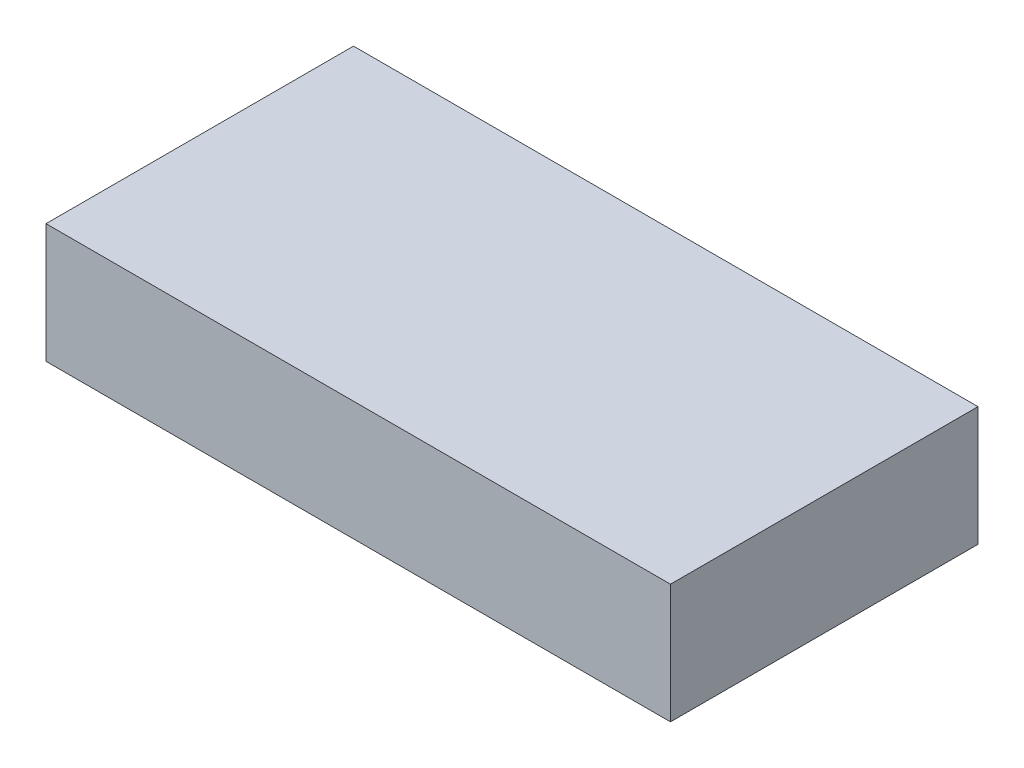
from build123d import *

# Parameters (mm, degrees)
SKETCH1_W           = 199
SKETCH1_H           = 98
BOSS_EXTRUDE1_DEPTH = 19


with BuildPart() as part:
    # Sketch1 → Boss-Extrude1 (new, symmetric)
    with BuildSketch(Plane(origin=(0, 0, 0), x_dir=(1, 0, 0), z_dir=(0, 1, 0))):
        Rectangle(SKETCH1_W, SKETCH1_H)
    extrude(amount=BOSS_EXTRUDE1_DEPTH, both=True)


solid = part.part
